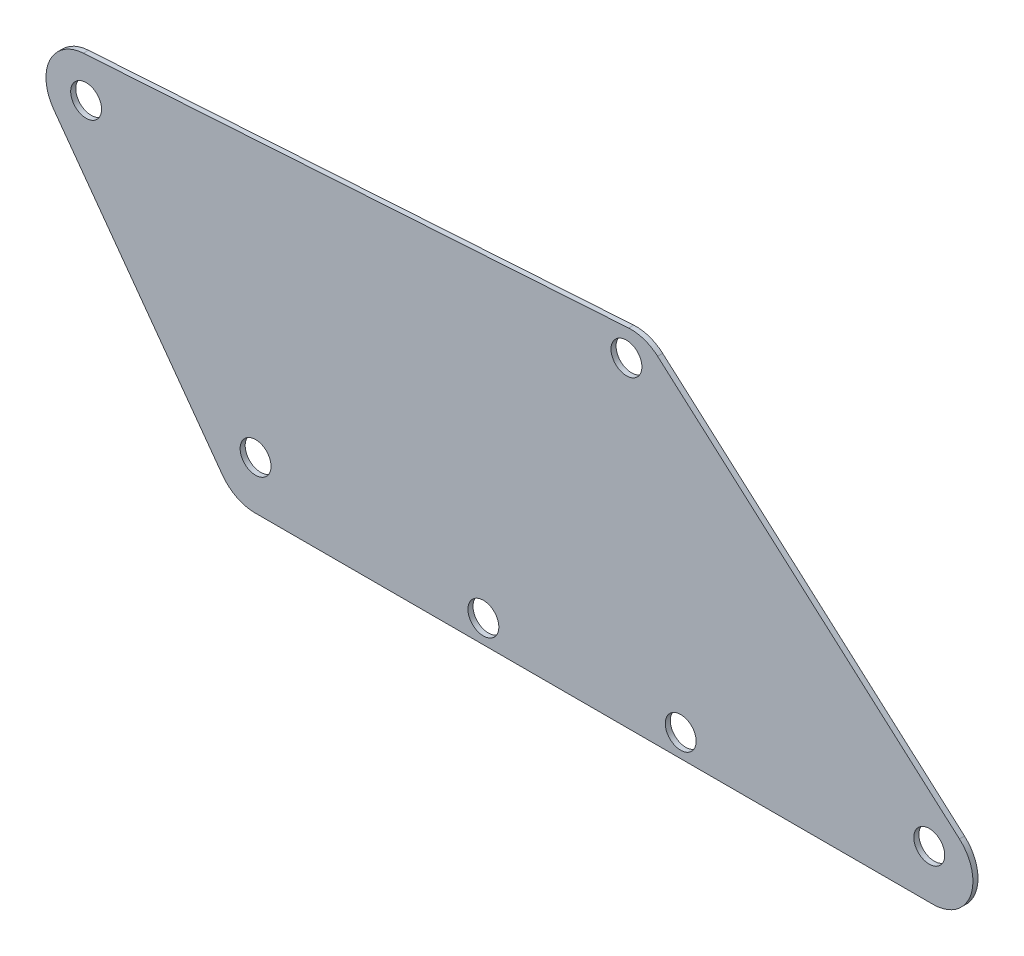
from build123d import *

# Parameters (mm, degrees)
SKETCH3_R           = 3.05
BOSS_EXTRUDE2_DEPTH = 1


with BuildPart() as part:
    # Sketch3 → Boss-Extrude2 (new body)
    with BuildSketch(Plane.XY):
        with BuildLine():
            ThreePointArc((-111.433713401, 5.24936764), (-108.634306546, 2.858213585), (-105.054427768, 1.998699544))
            Line((-105.054427768, 1.998699544), (28.809941074, 1.998699544))
            ThreePointArc((28.809941074, 1.998699544), (36.183192103, 7.089603476), (34.035282129, 15.788374442))
            Line((34.035282129, 15.788374442), (-25.553222822, 68.519965104))
            ThreePointArc((-25.553222822, 68.519965104), (-28.219469087, 70.073170265), (-31.27763344, 70.484200927))
            Line((-31.27763344, 70.484200927), (-138.901541854, 63.658495821))
            ThreePointArc((-138.901541854, 63.658495821), (-145.537646541, 59.145084312), (-144.781757924, 51.155253196))
            Line((-144.781757924, 51.155253196), (-111.433713401, 5.24936764))
        make_face()
        with Locations((-104.914769783, 11.544420828)):
            Circle(SKETCH3_R, mode=Mode.SUBTRACT)
        with Locations((-59.942900407, 6.552260768)):
            Circle(SKETCH3_R, mode=Mode.SUBTRACT)
        with Locations((-20.994102553, 6.497064076)):
            Circle(SKETCH3_R, mode=Mode.SUBTRACT)
        with Locations((28.072435844, 11.548553432)):
            Circle(SKETCH3_R, mode=Mode.SUBTRACT)
        with Locations((-138.361865478, 55.847842692)):
            Circle(SKETCH3_R, mode=Mode.SUBTRACT)
        with Locations((-31.700427911, 65.151862799)):
            Circle(SKETCH3_R, mode=Mode.SUBTRACT)
    extrude(amount=BOSS_EXTRUDE2_DEPTH)


solid = part.part
